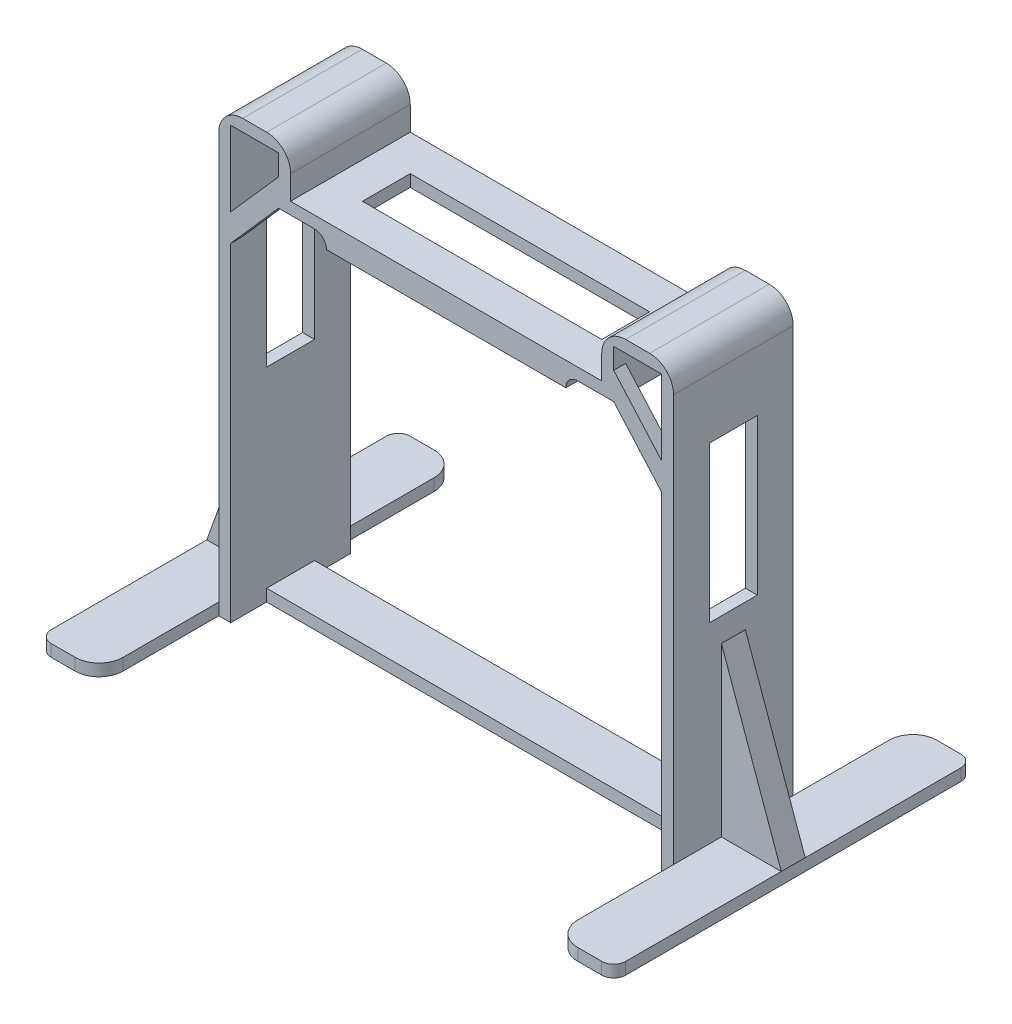
from build123d import *

# Parameters (mm, degrees)
EXTRUDE_1_DEPTH             = 50
SKETCH_2_W                  = 20.000664015
SKETCH_2_H                  = 5
EXTRUDE_2_DEPTH             = 240
EXTRUDE_3_DEPTH             = 50
EXTRUDE_3_DEPTH_BACK        = 100
SKETCH_3_W                  = 25
SKETCH_3_H                  = 5
RIB_2_REACH                 = 314.17
SKETCH_4_WALL_W             = 700.669994888
SKETCH_4_WALL_H             = 10
RIB_3_REACH                 = 314.17
SKETCH_5_WALL_W             = 700.669994888
SKETCH_5_WALL_H             = 10
CUT_EXTRUDE_START           = -190
SKETCH_6_W                  = 20
SKETCH_6_H                  = 65
CUT_EXTRUDE_1_DEPTH         = 190
SKETCH_7_W                  = 100
SKETCH_7_H                  = 20
CUT_EXTRUDE_2_DEPTH         = 5
EXTRUDE_5_DEPTH             = 5
MIRROR_2_COPY_1_DEPTH       = 5
EXTRUDE_6_REACH             = 244.126
SKETCH_10_W                 = 5
SKETCH_10_H                 = 5
EXTRUDE_6_DIRECTION_2_REACH = 244.126
FILLET_1_R                  = 5
FILLET_2_R                  = 5
FILLET_3_R                  = 5
FILLET_4_R                  = 5
FILLET_5_R                  = 10
FILLET_6_R                  = 5


with BuildPart() as part:
    # 草图1 → 凸台-拉伸1 (new body)
    with BuildSketch(Plane.XY):
        Polygon((0, 0), (30, 0), (30, 180), (50, 180), (50, 160), (190, 160), (190, 180), (210, 180), (210, 0), (240, 0), (240, 5), (215, 5), (215, 185), (185, 185), (185, 165), (55, 165), (55, 185), (25, 185), (25, 5), (0, 5), align=None)
    extrude(amount=EXTRUDE_1_DEPTH)

    # 草图2 → 凸台-拉伸2 (add)
    with BuildSketch(Plane.ZY):
        with Locations((25.000332008, 2.5)):
            Rectangle(SKETCH_2_W, SKETCH_2_H)
    extrude(amount=-EXTRUDE_2_DEPTH)

    # 草图3 → 凸台-拉伸3 (add, two sides: drawn at the far end of the back side and taken through both)
    with BuildSketch(Plane(origin=(0, 0, 0), x_dir=(-1, 0, 0), z_dir=(0, 0, -1)).offset(-EXTRUDE_3_DEPTH_BACK)):
        with Locations((-227.5, 2.5)):
            Rectangle(SKETCH_3_W, SKETCH_3_H)
        with Locations((-12.5, 2.5)):
            Rectangle(SKETCH_3_W, SKETCH_3_H)
    extrude(amount=EXTRUDE_3_DEPTH + EXTRUDE_3_DEPTH_BACK)

    # 草图4 wall → 筋2 (add, up to next)
    with BuildSketch(Plane(origin=(227.5, 40, 25), x_dir=(-0.336336396998, 0.941741911595, 0), z_dir=(0.941741911595, 0.336336396998, 0)), mode=Mode.PRIVATE) as rib_2_sk1:
        Rectangle(SKETCH_4_WALL_W, SKETCH_4_WALL_H)
    rib_2_tool1 = extrude(rib_2_sk1.sketch, amount=-RIB_2_REACH, mode=Mode.PRIVATE) - part.part
    add(rib_2_tool1.solids().sort_by_distance((227.5, 40, 25))[0])

    # 草图5 wall → 筋3 (add, up to next)
    with BuildSketch(Plane(origin=(12.5, 40, 25), x_dir=(-0.336336396998, -0.941741911595, 0), z_dir=(-0.941741911595, 0.336336396998, 0)), mode=Mode.PRIVATE) as rib_3_sk1:
        Rectangle(SKETCH_5_WALL_W, SKETCH_5_WALL_H)
    rib_3_tool1 = extrude(rib_3_sk1.sketch, amount=-RIB_3_REACH, mode=Mode.PRIVATE) - part.part
    add(rib_3_tool1.solids().sort_by_distance((12.5, 40, 25))[0])

    # 草图6 → 切除-拉伸1 (cut)
    with BuildSketch(Plane(origin=(215, 0, 0), x_dir=(0, 0, -1), z_dir=(1, 0, 0)).offset(CUT_EXTRUDE_START)):
        with Locations((-25, 117.5)):
            Rectangle(SKETCH_6_W, SKETCH_6_H)
    extrude(amount=CUT_EXTRUDE_1_DEPTH, mode=Mode.SUBTRACT)

    # 草图7 → 切除-拉伸2 (cut)
    with BuildSketch(Plane(origin=(0, 165, 0), x_dir=(1, 0, 0), z_dir=(0, 1, 0))):
        with Locations((120, -25)):
            Rectangle(SKETCH_7_W, SKETCH_7_H)
    extrude(amount=-CUT_EXTRUDE_2_DEPTH, mode=Mode.SUBTRACT)

    # 草图9 → 凸台-拉伸5 (add)
    with BuildSketch(Plane(origin=(0, 0, 0), x_dir=(-1, 0, 0), z_dir=(0, 0, -1))):
        Polygon((-190, 160), (-210, 137.300480815), (-210, 148.645505565), (-190, 171.34502475), align=None)
    extrude_5 = extrude(amount=-EXTRUDE_5_DEPTH)

    # 镜向1: 凸台-拉伸5 across plane
    add(extrude_5.mirror(Plane(origin=(0, 0, 25), x_dir=(1, 0, 0), z_dir=(0, 0, -1))))

    # 镜向2: 凸台-拉伸5 across plane
    add(extrude_5.mirror(Plane(origin=(120, 0, 0), x_dir=(0, 0, 1), z_dir=(1, 0, 0))))

    # 镜向2 copy 1 sketch → 镜向2 copy 1 (add)
    with BuildSketch(Plane(origin=(240, 0, 50), x_dir=(1, 0, 0), z_dir=(0, 0, 1))):
        Polygon((-190, 160), (-210, 137.300480815), (-210, 148.645505565), (-190, 171.34502475), align=None)
    extrude(amount=-MIRROR_2_COPY_1_DEPTH)

    # 凸台-拉伸6: up to this face of the body (flat: up to its plane)
    extrude_6_end = Plane(part.part.faces().sort_by_distance((170, 162.5, 25))[0])
    # 草图10 → 凸台-拉伸6 (add, up to the picked face)
    with BuildSketch(Plane(origin=(120, 0, 0), x_dir=(0, 0, -1), z_dir=(1, 0, 0)), mode=Mode.PRIVATE) as extrude_6_sk1:
        with Locations((-47.5, 157.5)):
            Rectangle(SKETCH_10_W, SKETCH_10_H)
    extrude_6_tool1 = split(extrude(extrude_6_sk1.sketch, amount=EXTRUDE_6_REACH, mode=Mode.PRIVATE), bisect_by=extrude_6_end, keep=Keep.BOTH, mode=Mode.PRIVATE)
    extrude_6 = extrude_6_tool1.solids().sort_by(Axis((120, 157.5, 47.5), (1, 0, 0)))[0]
    add(extrude_6)

    # 凸台-拉伸6 direction 2: up to this face of the body (flat: up to its plane)
    extrude_6_direction_2_end = Plane(part.part.faces().sort_by_distance((70, 162.5, 25))[0])
    # 草图10 → 凸台-拉伸6 direction 2 (add, up to the picked face)
    with BuildSketch(Plane(origin=(120, 0, 0), x_dir=(0, 0, -1), z_dir=(1, 0, 0)), mode=Mode.PRIVATE) as extrude_6_direction_2_sk1:
        with Locations((-47.5, 157.5)):
            Rectangle(SKETCH_10_W, SKETCH_10_H)
    extrude_6_direction_2_tool1 = split(extrude(extrude_6_direction_2_sk1.sketch, amount=-EXTRUDE_6_DIRECTION_2_REACH, mode=Mode.PRIVATE), bisect_by=extrude_6_direction_2_end, keep=Keep.BOTH, mode=Mode.PRIVATE)
    extrude_6_direction_2 = extrude_6_direction_2_tool1.solids().sort_by(Axis((120, 157.5, 47.5), (-1, 0, 0)))[0]
    add(extrude_6_direction_2)

    # 镜向3: 凸台-拉伸6, 凸台-拉伸6 direction 2 across plane
    add(extrude_6.mirror(Plane(origin=(0, 0, 25), x_dir=(1, 0, 0), z_dir=(0, 0, -1))))
    add(extrude_6_direction_2.mirror(Plane(origin=(0, 0, 25), x_dir=(1, 0, 0), z_dir=(0, 0, -1))))

    # 圆角1
    fillet_1_edges = [part.edges().sort_by_distance(p)[0] for p in [
        (70, 160, 47.5),
    ]]
    fillet(fillet_1_edges, radius=FILLET_1_R - 0.0001)  # a hair under: the kernel refuses the full size

    # 圆角2
    fillet_2_edges = [part.edges().sort_by_distance(p)[0] for p in [
        (170, 160, 47.5),
    ]]
    fillet(fillet_2_edges, radius=FILLET_2_R - 0.0001)  # a hair under: the kernel refuses the full size

    # 圆角3
    fillet_3_edges = [part.edges().sort_by_distance(p)[0] for p in [
        (170, 160, 2.5),
    ]]
    fillet(fillet_3_edges, radius=FILLET_3_R - 0.0001)  # a hair under: the kernel refuses the full size

    # 圆角4
    fillet_4_edges = [part.edges().sort_by_distance(p)[0] for p in [
        (70, 160, 2.5),
    ]]
    fillet(fillet_4_edges, radius=FILLET_4_R - 0.0001)  # a hair under: the kernel refuses the full size

    # 圆角5
    fillet_5_edges = [part.edges().sort_by_distance(p)[0] for p in [
        (215, 2.5, 100),
        (215, 2.5, -50),
        (25, 2.5, 100),
        (25, 2.5, -50),
        (25, 185, 25),
        (55, 185, 25),
        (185, 185, 25),
        (215, 185, 25),
    ]]
    fillet(fillet_5_edges, radius=FILLET_5_R)

    # 圆角6
    fillet_6_edges = [part.edges().sort_by_distance(p)[0] for p in [
        (240, 2.5, 100),
        (240, 2.5, -50),
        (0, 2.5, 100),
        (0, 2.5, -50),
    ]]
    fillet(fillet_6_edges, radius=FILLET_6_R)


solid = part.part
